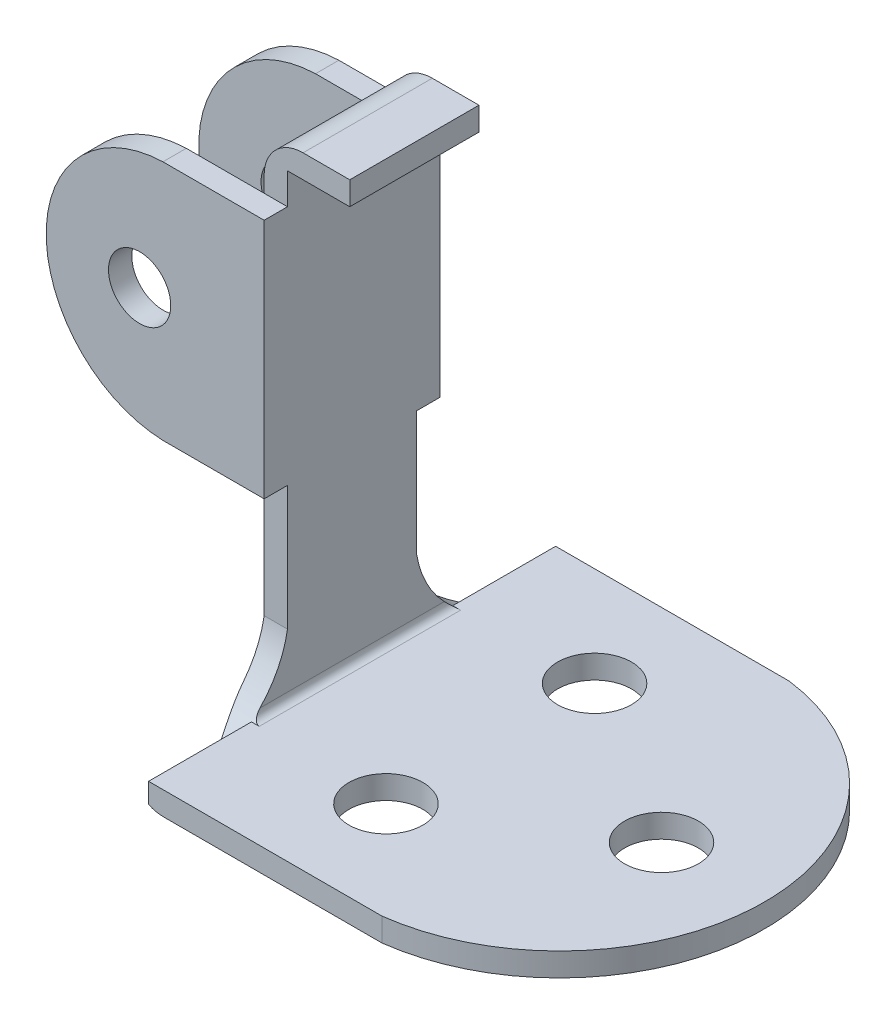
from build123d import *

# Parameters (mm, degrees)
SKETCH1_R           = 4.75
BOSS_EXTRUDE1_DEPTH = 3
BOSS_EXTRUDE3_DEPTH = 3
SKETCH4_W           = 11
SKETCH4_H           = 16.6
BOSS_EXTRUDE4_DEPTH = 3
SKETCH5_R           = 4
BOSS_EXTRUDE5_DEPTH = 3
FILLET6_R           = 5
FILLET7_R           = 1


with BuildPart() as part:
    # Sketch1 → Boss-Extrude1 (new body)
    with BuildSketch(Plane(origin=(0, 0, 0), x_dir=(1, 0, 0), z_dir=(0, 1, 0))):
        with BuildLine():
            Line((0, 26.15), (30, 26.15))
            ThreePointArc((30, 26.15), (53, 0), (30, -26.15))
            Line((30, -26.15), (0, -26.15))
            Line((0, -26.15), (0, 26.15))
        make_face()
        with Locations(Location((17.75, 13.4, 0), (0, 0, 270))):
            Circle(SKETCH1_R, mode=Mode.SUBTRACT)
        with Locations(Location((17.75, -13.4, 0), (0, 0, 270))):
            Circle(SKETCH1_R, mode=Mode.SUBTRACT)
        with Locations(Location((39.75, 0, 0), (0, 0, 270))):
            Circle(SKETCH1_R, mode=Mode.SUBTRACT)
    extrude(amount=BOSS_EXTRUDE1_DEPTH)

    # Sketch3 → Boss-Extrude3 (add)
    with BuildSketch(Plane.ZY):
        with BuildLine():
            Line((-8.3, 0), (8.3, 0))
            Line((8.3, 0), (21.3, 0))
            ThreePointArc((21.3, 0), (12.785306817, 3.118998966), (8.3, 11))
            Line((8.3, 11), (8.3, 62))
            Line((8.3, 62), (-8.3, 62))
            Line((-8.3, 62), (-8.3, 11))
            ThreePointArc((-8.3, 11), (-12.785306817, 3.118998966), (-21.3, 0))
            Line((-21.3, 0), (-8.3, 0))
        make_face()
    extrude(amount=BOSS_EXTRUDE3_DEPTH)

    # Sketch4 → Boss-Extrude4 (add)
    with BuildSketch(Plane(origin=(0, 62, 0), x_dir=(1, 0, 0), z_dir=(0, 1, 0))):
        with Locations((2.5, 0)):
            Rectangle(SKETCH4_W, SKETCH4_H)
    extrude(amount=BOSS_EXTRUDE4_DEPTH)

    # Sketch5 → Boss-Extrude5 (add)
    with BuildSketch(Plane.XY.offset(8.3)):
        with BuildLine():
            Line((0, 58), (0, 27))
            Line((0, 27), (-13, 27))
            ThreePointArc((-13, 27), (-28, 42.5), (-13, 58))
            Line((-13, 58), (0, 58))
        make_face()
        with Locations((-16, 42.5)):
            Circle(SKETCH5_R, mode=Mode.SUBTRACT)
    boss_extrude5 = extrude(amount=BOSS_EXTRUDE5_DEPTH)

    # Mirror1: Boss-Extrude5 across plane
    add(boss_extrude5.mirror(Plane.XY))

    # Fillet6
    # the kernel refuses this fillet: 5 mm, written as the material it takes off along each edge
    with BuildSketch(Plane(origin=(-3, 65, -20.8), x_dir=(0, -1, 0), z_dir=(0, 0, 1))) as fillet6_piece_1:
        with BuildLine():
            CenterArc((FILLET6_R, FILLET6_R), FILLET6_R, 180, 90)
            Line((0, FILLET6_R), (0, 0))
            Line((0, 0), (FILLET6_R, 0))
        make_face()
    extrude(amount=41.6, mode=Mode.SUBTRACT)
    with BuildSketch(Plane(origin=(-3, 0, 33.8), x_dir=(1, 0, 0), z_dir=(0, 0, -1))) as fillet6_piece_2:
        with BuildLine():
            CenterArc((FILLET6_R, -FILLET6_R), FILLET6_R, 90, 90)
            Line((0, -FILLET6_R), (0, 0))
            Line((0, 0), (FILLET6_R, 0))
        make_face()
    extrude(amount=67.6, mode=Mode.SUBTRACT)

    # Fillet7
    fillet7_edges = [part.edges().sort_by_distance(p)[0] for p in [
        (0, 3, 0),
    ]]
    fillet(fillet7_edges, radius=FILLET7_R)


solid = part.part
